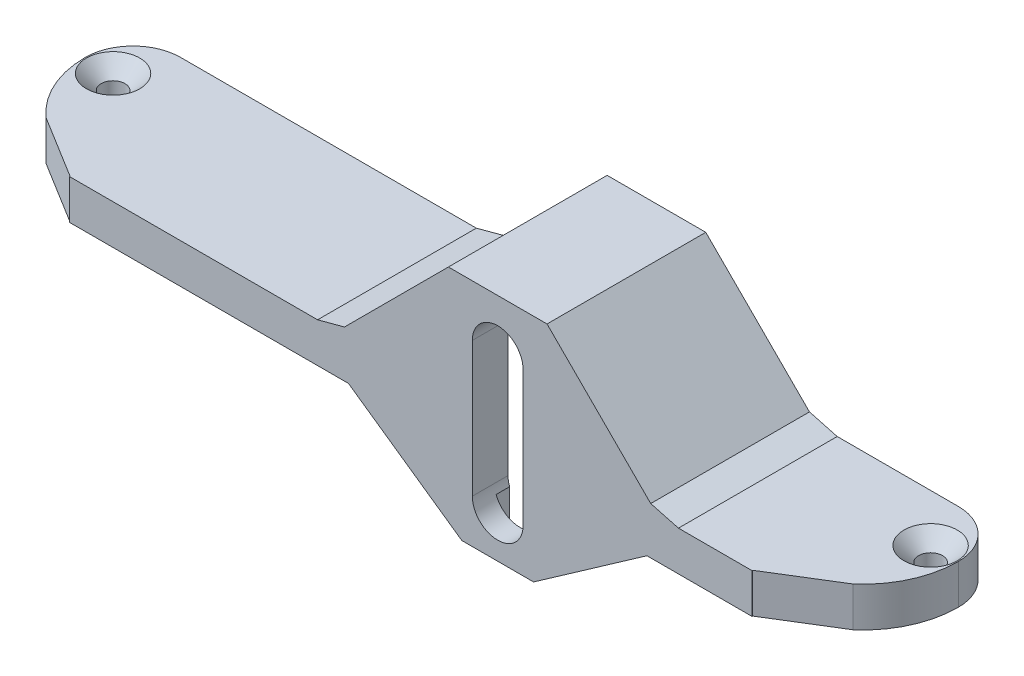
from build123d import *

# Parameters (mm, degrees)
BOSS_EXTRUDE1_DEPTH           = 3
CUT_EXTRUDE1_DEPTH            = 10
CUT_EXTRUDE3_START            = 8
SKETCH8_W                     = 6
SKETCH8_H                     = 3
CUT_EXTRUDE3_DEPTH            = 6
BOSS_EXTRUDE4_START           = 18
BOSS_EXTRUDE4_DEPTH           = 28
BOSS_EXTRUDE5_DEPTH           = 3
CUT_EXTRUDE4_DEPTH            = 3
CUT_EXTRUDE5_DEPTH            = 10
SKETCH18_R                    = 1.5
BOSS_EXTRUDE9_DEPTH           = 2
CHAMFER1_SIZE                 = 15
CHAMFER2_SIZE                 = 15
CHAMFER2_SIZE_2               = 10.503113073
CUT_EXTRUDE6_DEPTH            = 5
BOSS_EXTRUDE8_DEPTH           = 2
CHAMFER3_DEPTH                = 6
CHAMFER3_2_DEPTH              = 5
CSK_FOR_M3_SFHCS1_D           = 3
CSK_FOR_M3_SFHCS1_DEPTH       = 31.098709071
CSK_FOR_M3_SFHCS1_CSINK_D     = 6.72
CSK_FOR_M3_SFHCS1_CSINK_ANGLE = 90
CSK_FOR_M3_SFHCS1_TIP         = 0.901290929
CUT_EXTRUDE7_DEPTH            = 1.5
BOSS_EXTRUDE10_START          = -6
BOSS_EXTRUDE10_DEPTH          = 20
CHAMFER4_SIZE                 = 1.07179677
CHAMFER4_SIZE_2               = 4


with BuildPart() as part:
    # Sketch1 → Boss-Extrude1 (new body)
    with BuildSketch(Plane(origin=(0, 0, 0), x_dir=(1, 0, 0), z_dir=(0, 1, 0))):
        with BuildLine():
            ThreePointArc((-49, -6), (-53.242640687, -4.242640687), (-55, 0))
            ThreePointArc((-55, 0), (-51.485281374, -8.485281374), (-43, -12))
            Line((-43, -12), (43, -12))
            ThreePointArc((43, -12), (51.485281374, -8.485281374), (55, 0))
            ThreePointArc((55, 0), (53.242640687, -4.242640687), (49, -6))
            Line((49, -6), (-49, -6))
        make_face()
        with BuildLine():
            Line((-53, 0), (-55, 0))
            ThreePointArc((-55, 0), (-53.242640687, -4.242640687), (-49, -6))
            Line((-49, -6), (49, -6))
            ThreePointArc((49, -6), (53.242640687, -4.242640687), (55, 0))
            Line((55, 0), (53, 0))
            ThreePointArc((53, 0), (51.5, -1.5), (50, 0))
            Line((50, 0), (-50, 0))
            ThreePointArc((-50, 0), (-51.5, -1.5), (-53, 0))
        make_face()
        with BuildLine():
            Line((49, 6), (-49, 6))
            ThreePointArc((-49, 6), (-53.242640687, 4.242640687), (-55, 0))
            Line((-55, 0), (-53, 0))
            ThreePointArc((-53, 0), (-51.5, 1.5), (-50, 0))
            Line((-50, 0), (50, 0))
            ThreePointArc((50, 0), (51.5, 1.5), (53, 0))
            Line((53, 0), (55, 0))
            ThreePointArc((55, 0), (53.242640687, 4.242640687), (49, 6))
        make_face()
    extrude(amount=BOSS_EXTRUDE1_DEPTH)

    # Sketch2 → Cut-Extrude1 (cut)
    with BuildSketch(Plane(origin=(0, 3, 0), x_dir=(1, 0, 0), z_dir=(0, 1, 0))):
        Polygon((22, -8), (36, 6), (-14, 6), (0, -8), align=None)
    extrude(amount=-CUT_EXTRUDE1_DEPTH, mode=Mode.SUBTRACT)

    # Sketch8 → Cut-Extrude3 (cut)
    with BuildSketch(Plane.XY.offset(CUT_EXTRUDE3_START)):
        with Locations((10.960071178, 1.5)):
            Rectangle(SKETCH8_W, SKETCH8_H)
    extrude(amount=CUT_EXTRUDE3_DEPTH, mode=Mode.SUBTRACT)


with BuildPart() as cut_extrude3_piece_1:
    # of the separate pieces the step leaves, piece 1, a body of its own (cut_extrude3_pieces)
    add(part.part.solids().sort_by_distance((-55, 0, 0))[0])

    # Sketch9 → Boss-Extrude4 (add)
    with BuildSketch(Plane(origin=(0, 0, 0), x_dir=(1, 0, 0), z_dir=(0, 1, 0)).offset(BOSS_EXTRUDE4_START)):
        Polygon((13.960071178, -11.2), (13.960071178, -8), (14.760071178, -8), (14.760071178, -12), (7.160071178, -12), (7.160071178, -8), (7.960071178, -8), (7.960071178, -11.2), align=None)
    extrude(amount=-BOSS_EXTRUDE4_DEPTH)


with BuildPart() as cut_extrude3_piece_2:
    # of the separate pieces the step leaves, piece 2, a body of its own (cut_extrude3_pieces)
    add(part.part.solids().sort_by_distance((13.960071178, 0, 12))[0])


with BuildPart() as cut_extrude3_piece_1_1:
    add(cut_extrude3_piece_1.part)

    # Combine1: union Cut-Extrude3 piece 2
    add(cut_extrude3_piece_2.part)

    # Sketch11 → Boss-Extrude5 (add)
    with BuildSketch(Plane(origin=(0, 3, 0), x_dir=(1, 0, 0), z_dir=(0, 1, 0))):
        Polygon((-14, 6), (-12, 6), (2, -8), (0, -8), align=None)
        Polygon((20, -8), (34, 6), (36, 6), (22, -8), align=None)
    extrude(amount=-BOSS_EXTRUDE5_DEPTH)

    # Sketch13 → Cut-Extrude4 (cut)
    with BuildSketch(Plane(origin=(0, 3, 0), x_dir=(1, 0, 0), z_dir=(0, 1, 0))):
        Polygon((2, -8), (-2, -8), (-2, -4), align=None)
        Polygon((24, -4), (24, -8), (20, -8), align=None)
    extrude(amount=-CUT_EXTRUDE4_DEPTH, mode=Mode.SUBTRACT)

    # Sketch15 → Cut-Extrude5 (cut)
    with BuildSketch(Plane.XY.offset(12)):
        with BuildLine():
            Line((14.160071178, 12.5), (14.160071178, -4.5))
            ThreePointArc((14.160071178, -4.5), (10.960071178, -7.7), (7.760071178, -4.5))
            Line((7.760071178, -4.5), (7.760071178, 12.5))
            ThreePointArc((7.760071178, 12.5), (10.960071178, 15.7), (14.160071178, 12.5))
        make_face()
    extrude(amount=-CUT_EXTRUDE5_DEPTH, mode=Mode.SUBTRACT)

    # Sketch18 → Boss-Extrude9 (add)
    # profile 1 of 2: a face of its own
    with BuildSketch(Plane(origin=(0, 3, 0), x_dir=(1, 0, 0), z_dir=(0, 1, 0))):
        with BuildLine():
            Line((7.160071178, -8), (-2, -8))
            Line((-2, -8), (-2, -4))
            Line((-2, -4), (-12, 6))
            Line((-12, 6), (-49, 6))
            ThreePointArc((-49, 6), (-53.242640687, 4.242640687), (-55, 0))
            ThreePointArc((-55, 0), (-51.485281374, -8.485281374), (-43, -12))
            Line((-43, -12), (7.160071178, -12))
            Line((7.160071178, -12), (7.160071178, -8))
        make_face()
        with Locations(Location((-51.5, 0, 0), (0, 0, 270))):
            Circle(SKETCH18_R, mode=Mode.SUBTRACT)
    # profile 2 of 2: a face of its own
    with BuildSketch(Plane(origin=(0, 3, 0), x_dir=(1, 0, 0), z_dir=(0, 1, 0))):
        with BuildLine():
            Line((24, -4), (24, -8))
            Line((24, -8), (14.760071178, -8))
            Line((14.760071178, -8), (14.760071178, -12))
            Line((14.760071178, -12), (43, -12))
            ThreePointArc((43, -12), (51.485281374, -8.485281374), (55, 0))
            ThreePointArc((55, 0), (53.242640687, 4.242640687), (49, 6))
            Line((49, 6), (34, 6))
            Line((34, 6), (24, -4))
        make_face()
        with Locations(Location((51.5, 0, 0), (0, 0, 270))):
            Circle(SKETCH18_R, mode=Mode.SUBTRACT)
    extrude(amount=BOSS_EXTRUDE9_DEPTH)

    # Chamfer1
    # the kernel refuses this chamfer: 15 mm, written as the material it adds along each edge
    with BuildSketch(Plane(origin=(14.760071178, 5, 8), x_dir=(0, 1, 0), z_dir=(0, 0, 1))) as chamfer1_piece_1_section:
        Polygon((CHAMFER1_SIZE, 0), (0, -CHAMFER1_SIZE), (0, 0), align=None)
    chamfer1_piece_1 = extrude(amount=4, mode=Mode.PRIVATE)
    chamfer1_piece_1 = split(chamfer1_piece_1, bisect_by=Plane(origin=(14.760071178, 18, 8), z_dir=(0, -1, 0)), keep=Keep.TOP, mode=Mode.PRIVATE)
    chamfer1_piece_1 = split(chamfer1_piece_1, bisect_by=Plane(origin=(17.380035589, 5, 10.619964411), z_dir=(-0.7071067811865474, 0, -0.7071067811865477)), keep=Keep.TOP, mode=Mode.PRIVATE)
    add(chamfer1_piece_1)
    with BuildSketch(Plane(origin=(14.760071178, 5, -30.575244819), x_dir=(0, 1, 0), z_dir=(0, 0, 1))) as chamfer1_piece_2_section:
        Polygon((CHAMFER1_SIZE, 0), (0, -CHAMFER1_SIZE), (0, 0), align=None)
    chamfer1_piece_2 = extrude(amount=42.575244819, mode=Mode.PRIVATE)
    chamfer1_piece_2 = split(chamfer1_piece_2, bisect_by=Plane(origin=(14.760071178, 5, 8), z_dir=(0, 0, -1)), keep=Keep.TOP, mode=Mode.PRIVATE)
    chamfer1_piece_2 = split(chamfer1_piece_2, bisect_by=Plane(origin=(36.667657999, 5, -8.667657999), z_dir=(0.7071067811865474, 0, 0.7071067811865477)), keep=Keep.TOP, mode=Mode.PRIVATE)
    chamfer1_piece_2 = split(chamfer1_piece_2, bisect_by=Plane(origin=(24, 5, -30.575244819), z_dir=(1, 0, 0)), keep=Keep.TOP, mode=Mode.PRIVATE)
    add(chamfer1_piece_2)
    with BuildSketch(Plane(origin=(14.760071178, 5, 8), x_dir=(0, 1, 0), z_dir=(0, 0, 1))) as chamfer1_piece_3_section:
        Polygon((CHAMFER1_SIZE, 0), (0, -CHAMFER1_SIZE), (0, 0), align=None)
    chamfer1_piece_3 = extrude(amount=4, mode=Mode.PRIVATE)
    chamfer1_piece_3 = split(chamfer1_piece_3, bisect_by=Plane(origin=(14.760071178, 18, 8), z_dir=(0, -1, 0)), keep=Keep.TOP, mode=Mode.PRIVATE)
    chamfer1_piece_3 = split(chamfer1_piece_3, bisect_by=Plane(origin=(17.380035589, 5, 10.619964411), z_dir=(0.7071067811865474, 0, 0.7071067811865477)), keep=Keep.TOP, mode=Mode.PRIVATE)
    chamfer1_piece_3 = split(chamfer1_piece_3, bisect_by=Plane(origin=(24, 5, 8), z_dir=(-1, 0, 0)), keep=Keep.TOP, mode=Mode.PRIVATE)
    add(chamfer1_piece_3)
    with BuildSketch(Plane(origin=(14.760071178, 5, 8), x_dir=(0, 1, 0), z_dir=(0, 0, 1))) as chamfer1_piece_4_section:
        Polygon((CHAMFER1_SIZE, 0), (0, -CHAMFER1_SIZE), (0, 0), align=None)
    chamfer1_piece_4 = extrude(amount=4, mode=Mode.PRIVATE)
    chamfer1_piece_4 = split(chamfer1_piece_4, bisect_by=Plane(origin=(24, 5, 8), z_dir=(1, 0, 0)), keep=Keep.TOP, mode=Mode.PRIVATE)
    add(chamfer1_piece_4)
    with BuildSketch(Plane(origin=(7.160071178, 5, 12), x_dir=(0, 1, 0), z_dir=(0, 0, -1))) as chamfer1_piece_5_section:
        Polygon((CHAMFER1_SIZE, 0), (0, -CHAMFER1_SIZE), (0, 0), align=None)
    chamfer1_piece_5 = extrude(amount=4, mode=Mode.PRIVATE)
    chamfer1_piece_5 = split(chamfer1_piece_5, bisect_by=Plane(origin=(6.580035589, 5, 12.580035589), z_dir=(-0.7071067811865489, 0, 0.7071067811865461)), keep=Keep.TOP, mode=Mode.PRIVATE)
    chamfer1_piece_5 = split(chamfer1_piece_5, bisect_by=Plane(origin=(-2, 5, 12), z_dir=(1, 0, 0)), keep=Keep.TOP, mode=Mode.PRIVATE)
    chamfer1_piece_5 = split(chamfer1_piece_5, bisect_by=Plane(origin=(7.160071178, 18, 12), z_dir=(0, -1, 0)), keep=Keep.TOP, mode=Mode.PRIVATE)
    add(chamfer1_piece_5)
    with BuildSketch(Plane(origin=(7.160071178, 5, 12), x_dir=(0, 1, 0), z_dir=(0, 0, -1))) as chamfer1_piece_6_section:
        Polygon((CHAMFER1_SIZE, 0), (0, -CHAMFER1_SIZE), (0, 0), align=None)
    chamfer1_piece_6 = extrude(amount=4, mode=Mode.PRIVATE)
    chamfer1_piece_6 = split(chamfer1_piece_6, bisect_by=Plane(origin=(-2, 5, 12), z_dir=(-1, 0, 0)), keep=Keep.TOP, mode=Mode.PRIVATE)
    add(chamfer1_piece_6)
    with BuildSketch(Plane(origin=(7.160071178, 5, 12), x_dir=(0, 1, 0), z_dir=(0, 0, -1))) as chamfer1_piece_7_section:
        Polygon((CHAMFER1_SIZE, 0), (0, -CHAMFER1_SIZE), (0, 0), align=None)
    chamfer1_piece_7 = extrude(amount=4, mode=Mode.PRIVATE)
    chamfer1_piece_7 = split(chamfer1_piece_7, bisect_by=Plane(origin=(6.580035589, 5, 12.580035589), z_dir=(0.7071067811865489, 0, -0.7071067811865461)), keep=Keep.TOP, mode=Mode.PRIVATE)
    chamfer1_piece_7 = split(chamfer1_piece_7, bisect_by=Plane(origin=(7.160071178, 18, 12), z_dir=(0, -1, 0)), keep=Keep.TOP, mode=Mode.PRIVATE)
    add(chamfer1_piece_7)
    with BuildSketch(Plane(origin=(7.160071178, 5, 12), x_dir=(0, 1, 0), z_dir=(0, 0, -1))) as chamfer1_piece_8_section:
        Polygon((CHAMFER1_SIZE, 0), (0, -CHAMFER1_SIZE), (0, 0), align=None)
    chamfer1_piece_8 = extrude(amount=42.575244819, mode=Mode.PRIVATE)
    chamfer1_piece_8 = split(chamfer1_piece_8, bisect_by=Plane(origin=(6.580035589, 5, 12.580035589), z_dir=(-0.7071067811865489, 0, 0.7071067811865461)), keep=Keep.TOP, mode=Mode.PRIVATE)
    chamfer1_piece_8 = split(chamfer1_piece_8, bisect_by=Plane(origin=(-2, 5, 12), z_dir=(-1, 0, 0)), keep=Keep.TOP, mode=Mode.PRIVATE)
    chamfer1_piece_8 = split(chamfer1_piece_8, bisect_by=Plane(origin=(7.160071178, 5, 8), z_dir=(0, 0, -1)), keep=Keep.TOP, mode=Mode.PRIVATE)
    add(chamfer1_piece_8)

    # Chamfer2
    # the kernel refuses this chamfer: 15, 10.503113073 mm, written as the material it adds along each edge
    with BuildSketch(Plane(origin=(7.160071178, 0, 12), x_dir=(-1, 0, 0), z_dir=(0, 0, -1))) as chamfer2_piece_1_section:
        Polygon((CHAMFER2_SIZE, 0), (0, -CHAMFER2_SIZE_2), (0, 0), align=None)
    chamfer2_piece_1 = extrude(amount=4, mode=Mode.PRIVATE)
    chamfer2_piece_1 = split(chamfer2_piece_1, bisect_by=Plane(origin=(-2, 0, 12), z_dir=(-1, 0, 0)), keep=Keep.TOP, mode=Mode.PRIVATE)
    add(chamfer2_piece_1)
    with BuildSketch(Plane(origin=(7.160071178, 0, 12), x_dir=(-1, 0, 0), z_dir=(0, 0, -1))) as chamfer2_piece_2_section:
        Polygon((CHAMFER2_SIZE, 0), (0, -CHAMFER2_SIZE_2), (0, 0), align=None)
    chamfer2_piece_2 = extrude(amount=4, mode=Mode.PRIVATE)
    chamfer2_piece_2 = split(chamfer2_piece_2, bisect_by=Plane(origin=(6.580035589, 0, 12.580035589), z_dir=(-0.7071067811865476, 0, 0.7071067811865476)), keep=Keep.TOP, mode=Mode.PRIVATE)
    chamfer2_piece_2 = split(chamfer2_piece_2, bisect_by=Plane(origin=(-2, 0, 12), z_dir=(1, 0, 0)), keep=Keep.TOP, mode=Mode.PRIVATE)
    add(chamfer2_piece_2)
    with BuildSketch(Plane(origin=(7.160071178, 0, 12), x_dir=(-1, 0, 0), z_dir=(0, 0, -1))) as chamfer2_piece_3_section:
        Polygon((CHAMFER2_SIZE, 0), (0, -CHAMFER2_SIZE_2), (0, 0), align=None)
    chamfer2_piece_3 = extrude(amount=42.738283454, mode=Mode.PRIVATE)
    chamfer2_piece_3 = split(chamfer2_piece_3, bisect_by=Plane(origin=(6.580035589, 0, 12.580035589), z_dir=(-0.7071067811865476, 0, 0.7071067811865476)), keep=Keep.TOP, mode=Mode.PRIVATE)
    chamfer2_piece_3 = split(chamfer2_piece_3, bisect_by=Plane(origin=(7.160071178, 0, 8), z_dir=(0, 0, -1)), keep=Keep.TOP, mode=Mode.PRIVATE)
    chamfer2_piece_3 = split(chamfer2_piece_3, bisect_by=Plane(origin=(-2, 0, 12), z_dir=(-1, 0, 0)), keep=Keep.TOP, mode=Mode.PRIVATE)
    add(chamfer2_piece_3)
    with BuildSketch(Plane(origin=(7.160071178, 0, 12), x_dir=(-1, 0, 0), z_dir=(0, 0, -1))) as chamfer2_piece_4_section:
        Polygon((CHAMFER2_SIZE, 0), (0, -CHAMFER2_SIZE_2), (0, 0), align=None)
    chamfer2_piece_4 = extrude(amount=4, mode=Mode.PRIVATE)
    chamfer2_piece_4 = split(chamfer2_piece_4, bisect_by=Plane(origin=(6.580035589, 0, 12.580035589), z_dir=(0.7071067811865476, 0, -0.7071067811865476)), keep=Keep.TOP, mode=Mode.PRIVATE)
    chamfer2_piece_4 = split(chamfer2_piece_4, bisect_by=Plane(origin=(7.160071178, -10, 12), z_dir=(0, 1, 0)), keep=Keep.TOP, mode=Mode.PRIVATE)
    add(chamfer2_piece_4)
    with BuildSketch(Plane(origin=(14.760071178, 0, 12), x_dir=(0, -1, 0), z_dir=(0, 0, -1))) as chamfer2_piece_5_section:
        Polygon((CHAMFER2_SIZE_2, 0), (0, -CHAMFER2_SIZE), (0, 0), align=None)
    chamfer2_piece_5 = extrude(amount=4, mode=Mode.PRIVATE)
    chamfer2_piece_5 = split(chamfer2_piece_5, bisect_by=Plane(origin=(15.380035589, 0, 12.619964411), z_dir=(0.7071067811865476, 0, 0.7071067811865476)), keep=Keep.TOP, mode=Mode.PRIVATE)
    chamfer2_piece_5 = split(chamfer2_piece_5, bisect_by=Plane(origin=(24, 0, 12), z_dir=(-1, 0, 0)), keep=Keep.TOP, mode=Mode.PRIVATE)
    add(chamfer2_piece_5)
    with BuildSketch(Plane(origin=(14.760071178, 0, 12), x_dir=(0, -1, 0), z_dir=(0, 0, -1))) as chamfer2_piece_6_section:
        Polygon((CHAMFER2_SIZE_2, 0), (0, -CHAMFER2_SIZE), (0, 0), align=None)
    chamfer2_piece_6 = extrude(amount=4, mode=Mode.PRIVATE)
    chamfer2_piece_6 = split(chamfer2_piece_6, bisect_by=Plane(origin=(24, 0, 12), z_dir=(1, 0, 0)), keep=Keep.TOP, mode=Mode.PRIVATE)
    add(chamfer2_piece_6)
    with BuildSketch(Plane(origin=(14.760071178, 0, 12), x_dir=(0, -1, 0), z_dir=(0, 0, -1))) as chamfer2_piece_7_section:
        Polygon((CHAMFER2_SIZE_2, 0), (0, -CHAMFER2_SIZE), (0, 0), align=None)
    chamfer2_piece_7 = extrude(amount=4, mode=Mode.PRIVATE)
    chamfer2_piece_7 = split(chamfer2_piece_7, bisect_by=Plane(origin=(14.760071178, -10, 12), z_dir=(0, 1, 0)), keep=Keep.TOP, mode=Mode.PRIVATE)
    chamfer2_piece_7 = split(chamfer2_piece_7, bisect_by=Plane(origin=(15.380035589, 0, 12.619964411), z_dir=(-0.7071067811865476, 0, -0.7071067811865476)), keep=Keep.TOP, mode=Mode.PRIVATE)
    add(chamfer2_piece_7)
    with BuildSketch(Plane(origin=(14.760071178, 0, 12), x_dir=(0, -1, 0), z_dir=(0, 0, -1))) as chamfer2_piece_8_section:
        Polygon((CHAMFER2_SIZE_2, 0), (0, -CHAMFER2_SIZE), (0, 0), align=None)
    chamfer2_piece_8 = extrude(amount=42.738283454, mode=Mode.PRIVATE)
    chamfer2_piece_8 = split(chamfer2_piece_8, bisect_by=Plane(origin=(14.760071178, 0, 8), z_dir=(0, 0, -1)), keep=Keep.TOP, mode=Mode.PRIVATE)
    chamfer2_piece_8 = split(chamfer2_piece_8, bisect_by=Plane(origin=(15.380035589, 0, 12.619964411), z_dir=(0.7071067811865476, 0, 0.7071067811865476)), keep=Keep.TOP, mode=Mode.PRIVATE)
    chamfer2_piece_8 = split(chamfer2_piece_8, bisect_by=Plane(origin=(24, 0, 12), z_dir=(1, 0, 0)), keep=Keep.TOP, mode=Mode.PRIVATE)
    add(chamfer2_piece_8)

    # Sketch16 → Cut-Extrude6 (cut)
    with BuildSketch(Plane(origin=(0, 0, 0), x_dir=(1, 0, 0), z_dir=(0, 1, 0))):
        Polygon((-7.839928822, 1.839928822), (-2, -4), (-2, -8), (-7.839928822, -8), align=None)
        Polygon((24, -8), (24, -4), (29.760071178, 1.760071178), (29.760071178, -8), align=None)
    extrude(amount=-CUT_EXTRUDE6_DEPTH, mode=Mode.SUBTRACT)

    # Sketch17 → Boss-Extrude8 (add)
    with BuildSketch(Plane.XY.offset(12)):
        Polygon((-7.839928822, 0), (6.441551245, -10), (15.47859111, -10), (29.760071178, 0), (43, 0), (43, 5), (29.760071178, 5), (16.760071178, 18), (5.160071178, 18), (-7.839928822, 5), (-43, 5), (-43, 0), align=None)
        with BuildLine():
            Line((7.760071178, -4.5), (7.760071178, 12.5))
            ThreePointArc((7.760071178, 12.5), (10.960071178, 15.7), (14.160071178, 12.5))
            Line((14.160071178, 12.5), (14.160071178, -4.5))
            ThreePointArc((14.160071178, -4.5), (10.960071178, -7.7), (7.760071178, -4.5))
        make_face(mode=Mode.SUBTRACT)
    extrude(amount=BOSS_EXTRUDE8_DEPTH)

    # Chamfer3: read off the stored shape, not the designer's step
    # Chamfer3 outline → Chamfer3 (cut)
    with BuildSketch(Plane(origin=(0, 0, 0), x_dir=(1, 0, 0), z_dir=(0, 1, 0))):
        with BuildLine():
            ThreePointArc((47.608318931, -11.079864468), (49.300429772, -10.212961602), (50.834384089, -9.08968789))
            Line((50.834384089, -9.08968789), (47.608318931, -11.079864468))
        make_face()
        with BuildLine():
            ThreePointArc((-50.834384089, -9.08968789), (-49.300429772, -10.212961602), (-47.608318931, -11.079864468))
            Line((-47.608318931, -11.079864468), (-50.834384089, -9.08968789))
        make_face()
    extrude(amount=CHAMFER3_DEPTH, mode=Mode.SUBTRACT)

    # Chamfer3 2 outline → Chamfer3 2 (add)
    with BuildSketch(Plane(origin=(0, 0, 0), x_dir=(1, 0, 0), z_dir=(0, 1, 0))):
        with BuildLine():
            Line((43, -13.922760673), (47.608318931, -11.079864468))
            ThreePointArc((47.608318931, -11.079864468), (45.349641077, -11.767717995), (43, -12))
            Line((43, -12), (43, -13.922760673))
        make_face()
        with BuildLine():
            Line((-47.608318931, -11.079864468), (-43, -13.922760673))
            Line((-43, -13.922760673), (-43, -12))
            ThreePointArc((-43, -12), (-45.349641077, -11.767717995), (-47.608318931, -11.079864468))
        make_face()
    extrude(amount=CHAMFER3_2_DEPTH)

    # CSK for M3 SFHCS1
    with Locations(Plane(origin=(0, 5, 0), x_dir=(1, 0, 0), z_dir=(0, 1, 0))):
        with Locations((-51.5, 0), (51.5, 0)):
            CounterSinkHole(CSK_FOR_M3_SFHCS1_D / 2, CSK_FOR_M3_SFHCS1_CSINK_D / 2, depth=CSK_FOR_M3_SFHCS1_DEPTH, counter_sink_angle=CSK_FOR_M3_SFHCS1_CSINK_ANGLE)
            with Locations((0, 0, -(CSK_FOR_M3_SFHCS1_DEPTH + CSK_FOR_M3_SFHCS1_TIP / 2))):  # 118° drill point
                Cone(0, CSK_FOR_M3_SFHCS1_D / 2, CSK_FOR_M3_SFHCS1_TIP, mode=Mode.SUBTRACT)

    # Sketch21 → Cut-Extrude7 (cut)
    with BuildSketch(Plane(origin=(0, 0, 8), x_dir=(-1, 0, 0), z_dir=(0, 0, -1))):
        Polygon((-13.960071178, -10), (-13.960071178, 18), (-16.760071178, 18), (-16.760071178, -9.102697997), (-15.47859111, -10), align=None)
        Polygon((-7.960071178, -10), (-7.960071178, 18), (-5.160071178, 18), (-5.160071178, -9.102697997), (-6.441551245, -10), align=None)
    extrude(amount=-CUT_EXTRUDE7_DEPTH, mode=Mode.SUBTRACT)

    # Sketch22 → Boss-Extrude10 (add)
    with BuildSketch(Plane.XY.offset(BOSS_EXTRUDE10_START)):
        Polygon((34, 3), (28.931644053, 3), (15.931644053, 16), (5.988498302, 16), (-7.011501698, 3), (-12, 3), (-12, 6), (-8.254142385, 6), (4.745857615, 19), (17.17428474, 19), (30.17428474, 6), (34, 6), align=None)
    extrude(amount=BOSS_EXTRUDE10_DEPTH)

    # Chamfer4
    # the kernel refuses this chamfer: 4, 1.07179677 mm, written as the material it takes off along each edge
    with BuildSketch(Plane(origin=(-12, 6, -16.386886281), x_dir=(0, -1, 0), z_dir=(0, 0, 1))) as chamfer4_piece_1_section:
        Polygon((CHAMFER4_SIZE, 0), (0, CHAMFER4_SIZE_2), (0, 0), align=None)
    chamfer4_piece_1 = extrude(amount=40.773772562, mode=Mode.PRIVATE)
    chamfer4_piece_1 = split(chamfer4_piece_1, bisect_by=Plane(origin=(-12, 5, -16.386886281), z_dir=(0, 1, 0)), keep=Keep.TOP, mode=Mode.PRIVATE)
    chamfer4_piece_1 = split(chamfer4_piece_1, bisect_by=Plane(origin=(-10.127071192, 4.127071192, -16.386886281), z_dir=(-0.707106781186548, 0.7071067811865472, 0)), keep=Keep.TOP, mode=Mode.PRIVATE)
    add(chamfer4_piece_1, mode=Mode.SUBTRACT)
    with BuildSketch(Plane(origin=(34, 6, -16.386886281), x_dir=(-1, 0, 0), z_dir=(0, 0, 1))) as chamfer4_piece_2_section:
        Polygon((CHAMFER4_SIZE_2, 0), (0, CHAMFER4_SIZE), (0, 0), align=None)
    chamfer4_piece_2 = extrude(amount=40.773772562, mode=Mode.PRIVATE)
    chamfer4_piece_2 = split(chamfer4_piece_2, bisect_by=Plane(origin=(34, 5, -16.386886281), z_dir=(0, 1, 0)), keep=Keep.TOP, mode=Mode.PRIVATE)
    chamfer4_piece_2 = split(chamfer4_piece_2, bisect_by=Plane(origin=(32.08714237, 4.08714237, -16.386886281), z_dir=(0.7071067811865475, 0.7071067811865476, 0)), keep=Keep.TOP, mode=Mode.PRIVATE)
    add(chamfer4_piece_2, mode=Mode.SUBTRACT)


solid = cut_extrude3_piece_1_1.part
